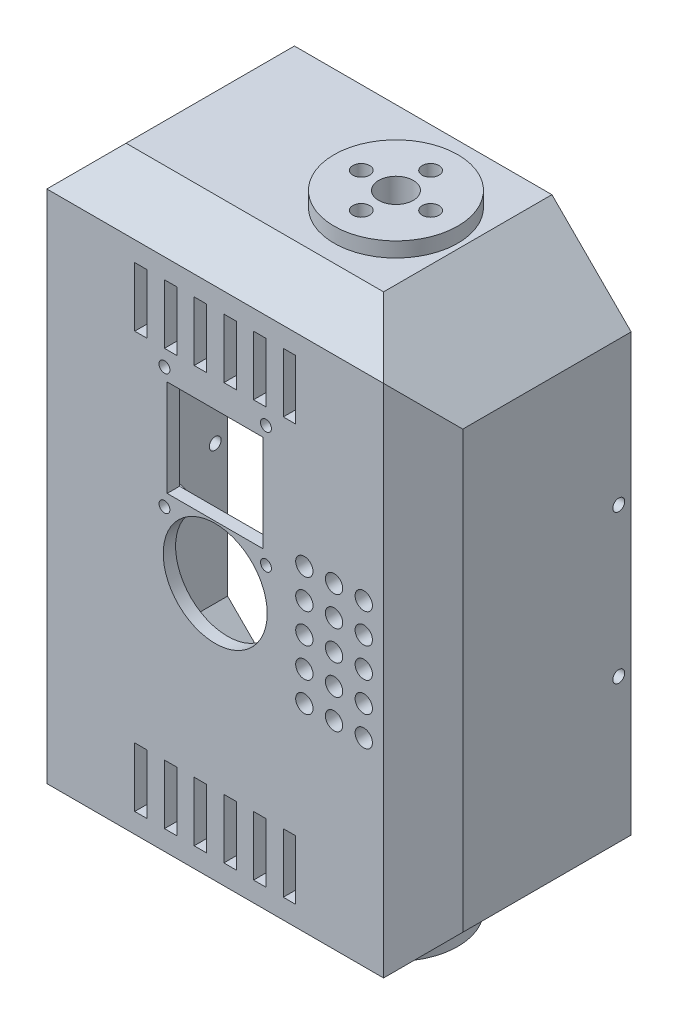
from build123d import *

# Parameters (mm, degrees)
BOSS_1_DEPTH    = 42
CUT_2_DEPTH     = 86
CUT_3_DEPTH     = 86
CUT_4_DEPTH     = 122
CUT_5_DEPTH     = 122
CUT_6_DEPTH     = 31.6
CUT_7_DEPTH     = 4.1
CUT_8_DEPTH     = 4.1
S_CUT9_W        = 2.5
S_CUT9_H        = 12
POCKET_9_DEPTH  = 2.7
S_CUT10_W       = 2.5
S_CUT10_H       = 12
POCKET_10_DEPTH = 2.7
S_CUT11_W       = 2.5
S_CUT11_H       = 12
POCKET_11_DEPTH = 2.7
S_CUT12_W       = 2.5
S_CUT12_H       = 12
POCKET_12_DEPTH = 2.7
S_CUT13_W       = 2.5
S_CUT13_H       = 12
POCKET_13_DEPTH = 2.7
S_CUT14_W       = 2.5
S_CUT14_H       = 12
POCKET_14_DEPTH = 2.7
S_HOLE15_R      = 1.2
HOLE_15_DEPTH   = 2.7
S_HOLE16_R      = 1.2
HOLE_16_DEPTH   = 2.7
S_CUT17_W       = 2.5
S_CUT17_H       = 12
POCKET_17_DEPTH = 2.7
S_CUT18_W       = 2.5
S_CUT18_H       = 12
POCKET_18_DEPTH = 2.7
S_CUT19_W       = 2.5
S_CUT19_H       = 12
POCKET_19_DEPTH = 2.7
S_CUT20_W       = 2.5
S_CUT20_H       = 12
POCKET_20_DEPTH = 2.7
S_CUT21_W       = 2.5
S_CUT21_H       = 12
POCKET_21_DEPTH = 2.7
S_CUT22_W       = 2.5
S_CUT22_H       = 12
POCKET_22_DEPTH = 2.7
S_HOLE23_R      = 1.2
HOLE_23_DEPTH   = 2.7
S_HOLE24_R      = 1.2
HOLE_24_DEPTH   = 2.7
S_HOLE25_R      = 1.75
HOLE_25_DEPTH   = 2.7
S_HOLE26_R      = 1.75
HOLE_26_DEPTH   = 2.7
S_HOLE27_R      = 1.75
HOLE_27_DEPTH   = 2.7
S_HOLE28_R      = 1.75
HOLE_28_DEPTH   = 2.7
S_HOLE29_R      = 1.75
HOLE_29_DEPTH   = 2.7
S_HOLE30_R      = 1.75
HOLE_30_DEPTH   = 2.7
S_HOLE31_R      = 1.75
HOLE_31_DEPTH   = 2.7
S_HOLE32_R      = 1.75
HOLE_32_DEPTH   = 2.7
S_HOLE33_R      = 1.75
HOLE_33_DEPTH   = 2.7
S_HOLE34_R      = 1.75
HOLE_34_DEPTH   = 2.7
S_HOLE35_R      = 1.75
HOLE_35_DEPTH   = 2.7
S_HOLE36_R      = 1.75
HOLE_36_DEPTH   = 2.7
S_HOLE37_R      = 1.75
HOLE_37_DEPTH   = 2.7
S_HOLE38_R      = 1.75
HOLE_38_DEPTH   = 2.7
S_HOLE39_R      = 1.75
HOLE_39_DEPTH   = 2.7
S_CYL40_R       = 12.5
BOSS_40_DEPTH   = 6
S_CYL41_R       = 12.5
BOSS_41_DEPTH   = 6
S_CYL42_R       = 2.5
BOSS_42_DEPTH   = 2
S_CYL43_R       = 2.5
BOSS_43_DEPTH   = 2
S_CYL44_R       = 2.5
BOSS_44_DEPTH   = 2
S_CYL45_R       = 2.5
BOSS_45_DEPTH   = 2
S_HOLE46_R      = 3.5
HOLE_46_DEPTH   = 6.2
S_HOLE47_R      = 1.7
HOLE_47_DEPTH   = 6.2
S_HOLE48_R      = 1.7
HOLE_48_DEPTH   = 6.2
S_HOLE49_R      = 1.7
HOLE_49_DEPTH   = 6.2
S_HOLE50_R      = 1.7
HOLE_50_DEPTH   = 6.2
S_HOLE51_R      = 3.2
HOLE_51_DEPTH   = 3.1
S_HOLE52_R      = 3.2
HOLE_52_DEPTH   = 3.1
S_HOLE53_R      = 3.2
HOLE_53_DEPTH   = 3.1
S_HOLE54_R      = 3.2
HOLE_54_DEPTH   = 3.1
S_HOLE55_R      = 3.5
HOLE_55_DEPTH   = 6.2
S_HOLE56_R      = 1.7
HOLE_56_DEPTH   = 6.2
S_HOLE57_R      = 1.7
HOLE_57_DEPTH   = 6.2
S_HOLE58_R      = 1.7
HOLE_58_DEPTH   = 6.2
S_HOLE59_R      = 1.7
HOLE_59_DEPTH   = 6.2
S_HOLE60_R      = 3.2
HOLE_60_DEPTH   = 3.1
S_HOLE61_R      = 3.2
HOLE_61_DEPTH   = 3.1
S_HOLE62_R      = 3.2
HOLE_62_DEPTH   = 3.1
S_HOLE63_R      = 3.2
HOLE_63_DEPTH   = 3.1
S_HOLE64_R      = 10.5
HOLE_64_DEPTH   = 6.1
S_CUT65_W       = 19.4
S_CUT65_H       = 19.5
POCKET_65_DEPTH = 6.1
S_HOLE66_R      = 1.1
HOLE_66_DEPTH   = 3.2
S_HOLE67_R      = 1.1
HOLE_67_DEPTH   = 3.2
S_HOLE68_R      = 1.1
HOLE_68_DEPTH   = 3.2
S_HOLE69_R      = 1.1
HOLE_69_DEPTH   = 3.2


with BuildPart() as part:
    # S_prism1 → Boss_1 (new body)
    with BuildSketch(Plane.XY.offset(194)):
        Polygon((42, -44), (42, 44), (26, 60), (-26, 60), (-42, 44), (-42, -44), (-26, -60), (26, -60), align=None)
    extrude(amount=BOSS_1_DEPTH)

    # S_pcut2 → Cut_2 (cut)
    with BuildSketch(Plane(origin=(-43, 0, 0), x_dir=(0, 0, -1), z_dir=(1, 0, 0))):
        Polygon((-236.6, 60.6), (-236.6, 51.4), (-227.4, 60.6), align=None)
    extrude(amount=CUT_2_DEPTH, mode=Mode.SUBTRACT)

    # S_pcut3 → Cut_3 (cut)
    with BuildSketch(Plane(origin=(-43, 0, 0), x_dir=(0, 0, -1), z_dir=(1, 0, 0))):
        Polygon((-236.6, -60.6), (-236.6, -51.4), (-227.4, -60.6), align=None)
    extrude(amount=CUT_3_DEPTH, mode=Mode.SUBTRACT)

    # S_pcut4 → Cut_4 (cut)
    with BuildSketch(Plane(origin=(0, -61, 0), x_dir=(1, 0, 0), z_dir=(0, 1, 0))):
        Polygon((42.6, -236.6), (33.4, -236.6), (42.6, -227.4), align=None)
    extrude(amount=CUT_4_DEPTH, mode=Mode.SUBTRACT)

    # S_pcut5 → Cut_5 (cut)
    with BuildSketch(Plane(origin=(0, -61, 0), x_dir=(1, 0, 0), z_dir=(0, 1, 0))):
        Polygon((-42.6, -236.6), (-33.4, -236.6), (-42.6, -227.4), align=None)
    extrude(amount=CUT_5_DEPTH, mode=Mode.SUBTRACT)

    # S_pcut6 → Cut_6 (cut)
    with BuildSketch(Plane.XY.offset(193.9)):
        Polygon((39.5, -42.964466094), (39.5, 42.964466094), (24.964466094, 57.5), (-24.964466094, 57.5), (-39.5, 42.964466094), (-39.5, -42.964466094), (-24.964466094, -57.5), (24.964466094, -57.5), align=None)
    extrude(amount=CUT_6_DEPTH, mode=Mode.SUBTRACT)

    # S_pcut7 → Cut_7 (cut)
    with BuildSketch(Plane.XY.offset(225.4)):
        Polygon((35.5, -41.307611845), (35.5, 41.307611845), (23.307611845, 53.5), (-23.307611845, 53.5), (-35.5, 41.307611845), (-35.5, -41.307611845), (-23.307611845, -53.5), (23.307611845, -53.5), align=None)
    extrude(amount=CUT_7_DEPTH, mode=Mode.SUBTRACT)

    # S_pcut8 → Cut_8 (cut)
    with BuildSketch(Plane.XY.offset(229.4)):
        Polygon((31.5, -39.650757595), (31.5, 39.650757595), (21.650757595, 49.5), (-21.650757595, 49.5), (-31.5, 39.650757595), (-31.5, -39.650757595), (-21.650757595, -49.5), (21.650757595, -49.5), align=None)
    extrude(amount=CUT_8_DEPTH, mode=Mode.SUBTRACT)

    # S_cut9 → Pocket_9 (cut)
    with BuildSketch(Plane.XY.offset(233.4)):
        with Locations((-15, 42)):
            Rectangle(S_CUT9_W, S_CUT9_H)
    extrude(amount=POCKET_9_DEPTH, mode=Mode.SUBTRACT)

    # S_cut10 → Pocket_10 (cut)
    with BuildSketch(Plane.XY.offset(233.4)):
        with Locations((-9, 42)):
            Rectangle(S_CUT10_W, S_CUT10_H)
    extrude(amount=POCKET_10_DEPTH, mode=Mode.SUBTRACT)

    # S_cut11 → Pocket_11 (cut)
    with BuildSketch(Plane.XY.offset(233.4)):
        with Locations((-3, 42)):
            Rectangle(S_CUT11_W, S_CUT11_H)
    extrude(amount=POCKET_11_DEPTH, mode=Mode.SUBTRACT)

    # S_cut12 → Pocket_12 (cut)
    with BuildSketch(Plane.XY.offset(233.4)):
        with Locations((3, 42)):
            Rectangle(S_CUT12_W, S_CUT12_H)
    extrude(amount=POCKET_12_DEPTH, mode=Mode.SUBTRACT)

    # S_cut13 → Pocket_13 (cut)
    with BuildSketch(Plane.XY.offset(233.4)):
        with Locations((9, 42)):
            Rectangle(S_CUT13_W, S_CUT13_H)
    extrude(amount=POCKET_13_DEPTH, mode=Mode.SUBTRACT)

    # S_cut14 → Pocket_14 (cut)
    with BuildSketch(Plane.XY.offset(233.4)):
        with Locations((15, 42)):
            Rectangle(S_CUT14_W, S_CUT14_H)
    extrude(amount=POCKET_14_DEPTH, mode=Mode.SUBTRACT)

    # S_hole15 → Hole_15 (cut)
    with BuildSketch(Plane(origin=(39.4, 0, 0), x_dir=(0, 0, -1), z_dir=(1, 0, 0))):
        with Locations((-196.5, -15)):
            Circle(S_HOLE15_R)
    extrude(amount=HOLE_15_DEPTH, mode=Mode.SUBTRACT)

    # S_hole16 → Hole_16 (cut)
    with BuildSketch(Plane(origin=(39.4, 0, 0), x_dir=(0, 0, -1), z_dir=(1, 0, 0))):
        with Locations((-196.5, 15)):
            Circle(S_HOLE16_R)
    extrude(amount=HOLE_16_DEPTH, mode=Mode.SUBTRACT)

    # S_cut17 → Pocket_17 (cut)
    with BuildSketch(Plane.XY.offset(233.4)):
        with Locations((-15, -42)):
            Rectangle(S_CUT17_W, S_CUT17_H)
    extrude(amount=POCKET_17_DEPTH, mode=Mode.SUBTRACT)

    # S_cut18 → Pocket_18 (cut)
    with BuildSketch(Plane.XY.offset(233.4)):
        with Locations((-9, -42)):
            Rectangle(S_CUT18_W, S_CUT18_H)
    extrude(amount=POCKET_18_DEPTH, mode=Mode.SUBTRACT)

    # S_cut19 → Pocket_19 (cut)
    with BuildSketch(Plane.XY.offset(233.4)):
        with Locations((-3, -42)):
            Rectangle(S_CUT19_W, S_CUT19_H)
    extrude(amount=POCKET_19_DEPTH, mode=Mode.SUBTRACT)

    # S_cut20 → Pocket_20 (cut)
    with BuildSketch(Plane.XY.offset(233.4)):
        with Locations((3, -42)):
            Rectangle(S_CUT20_W, S_CUT20_H)
    extrude(amount=POCKET_20_DEPTH, mode=Mode.SUBTRACT)

    # S_cut21 → Pocket_21 (cut)
    with BuildSketch(Plane.XY.offset(233.4)):
        with Locations((9, -42)):
            Rectangle(S_CUT21_W, S_CUT21_H)
    extrude(amount=POCKET_21_DEPTH, mode=Mode.SUBTRACT)

    # S_cut22 → Pocket_22 (cut)
    with BuildSketch(Plane.XY.offset(233.4)):
        with Locations((15, -42)):
            Rectangle(S_CUT22_W, S_CUT22_H)
    extrude(amount=POCKET_22_DEPTH, mode=Mode.SUBTRACT)

    # S_hole23 → Hole_23 (cut)
    with BuildSketch(Plane(origin=(-42.1, 0, 0), x_dir=(0, 0, -1), z_dir=(1, 0, 0))):
        with Locations((-196.5, -15)):
            Circle(S_HOLE23_R)
    extrude(amount=HOLE_23_DEPTH, mode=Mode.SUBTRACT)

    # S_hole24 → Hole_24 (cut)
    with BuildSketch(Plane(origin=(-42.1, 0, 0), x_dir=(0, 0, -1), z_dir=(1, 0, 0))):
        with Locations((-196.5, 15)):
            Circle(S_HOLE24_R)
    extrude(amount=HOLE_24_DEPTH, mode=Mode.SUBTRACT)

    # S_hole25 → Hole_25 (cut)
    with BuildSketch(Plane.XY.offset(233.4)):
        with Locations((18, -12)):
            Circle(S_HOLE25_R)
    extrude(amount=HOLE_25_DEPTH, mode=Mode.SUBTRACT)

    # S_hole26 → Hole_26 (cut)
    with BuildSketch(Plane.XY.offset(233.4)):
        with Locations((18, -6)):
            Circle(S_HOLE26_R)
    extrude(amount=HOLE_26_DEPTH, mode=Mode.SUBTRACT)

    # S_hole27 → Hole_27 (cut)
    with BuildSketch(Plane.XY.offset(233.4)):
        with Locations((18, 0)):
            Circle(S_HOLE27_R)
    extrude(amount=HOLE_27_DEPTH, mode=Mode.SUBTRACT)

    # S_hole28 → Hole_28 (cut)
    with BuildSketch(Plane.XY.offset(233.4)):
        with Locations((18, 6)):
            Circle(S_HOLE28_R)
    extrude(amount=HOLE_28_DEPTH, mode=Mode.SUBTRACT)

    # S_hole29 → Hole_29 (cut)
    with BuildSketch(Plane.XY.offset(233.4)):
        with Locations((18, 12)):
            Circle(S_HOLE29_R)
    extrude(amount=HOLE_29_DEPTH, mode=Mode.SUBTRACT)

    # S_hole30 → Hole_30 (cut)
    with BuildSketch(Plane.XY.offset(233.4)):
        with Locations((24, -12)):
            Circle(S_HOLE30_R)
    extrude(amount=HOLE_30_DEPTH, mode=Mode.SUBTRACT)

    # S_hole31 → Hole_31 (cut)
    with BuildSketch(Plane.XY.offset(233.4)):
        with Locations((24, -6)):
            Circle(S_HOLE31_R)
    extrude(amount=HOLE_31_DEPTH, mode=Mode.SUBTRACT)

    # S_hole32 → Hole_32 (cut)
    with BuildSketch(Plane.XY.offset(233.4)):
        with Locations((24, 0)):
            Circle(S_HOLE32_R)
    extrude(amount=HOLE_32_DEPTH, mode=Mode.SUBTRACT)

    # S_hole33 → Hole_33 (cut)
    with BuildSketch(Plane.XY.offset(233.4)):
        with Locations((24, 6)):
            Circle(S_HOLE33_R)
    extrude(amount=HOLE_33_DEPTH, mode=Mode.SUBTRACT)

    # S_hole34 → Hole_34 (cut)
    with BuildSketch(Plane.XY.offset(233.4)):
        with Locations((24, 12)):
            Circle(S_HOLE34_R)
    extrude(amount=HOLE_34_DEPTH, mode=Mode.SUBTRACT)

    # S_hole35 → Hole_35 (cut)
    with BuildSketch(Plane.XY.offset(233.4)):
        with Locations((30, -12)):
            Circle(S_HOLE35_R)
    extrude(amount=HOLE_35_DEPTH, mode=Mode.SUBTRACT)

    # S_hole36 → Hole_36 (cut)
    with BuildSketch(Plane.XY.offset(233.4)):
        with Locations((30, -6)):
            Circle(S_HOLE36_R)
    extrude(amount=HOLE_36_DEPTH, mode=Mode.SUBTRACT)

    # S_hole37 → Hole_37 (cut)
    with BuildSketch(Plane.XY.offset(233.4)):
        with Locations((30, 0)):
            Circle(S_HOLE37_R)
    extrude(amount=HOLE_37_DEPTH, mode=Mode.SUBTRACT)

    # S_hole38 → Hole_38 (cut)
    with BuildSketch(Plane.XY.offset(233.4)):
        with Locations((30, 6)):
            Circle(S_HOLE38_R)
    extrude(amount=HOLE_38_DEPTH, mode=Mode.SUBTRACT)

    # S_hole39 → Hole_39 (cut)
    with BuildSketch(Plane.XY.offset(233.4)):
        with Locations((30, 12)):
            Circle(S_HOLE39_R)
    extrude(amount=HOLE_39_DEPTH, mode=Mode.SUBTRACT)

    # S_cyl40 → Boss_40 (add)
    with BuildSketch(Plane(origin=(0, 57, 0), x_dir=(1, 0, 0), z_dir=(0, 1, 0))):
        with Locations((12.5, -212)):
            Circle(S_CYL40_R)
    extrude(amount=BOSS_40_DEPTH)

    # S_cyl41 → Boss_41 (add)
    with BuildSketch(Plane(origin=(0, -63, 0), x_dir=(1, 0, 0), z_dir=(0, 1, 0))):
        with Locations((12.5, -212)):
            Circle(S_CYL41_R)
    extrude(amount=BOSS_41_DEPTH)

    # S_cyl42 → Boss_42 (add)
    with BuildSketch(Plane.XY.offset(233)):
        with Locations((-10.25, 8.3)):
            Circle(S_CYL42_R)
    extrude(amount=BOSS_42_DEPTH)

    # S_cyl43 → Boss_43 (add)
    with BuildSketch(Plane.XY.offset(233)):
        with Locations((10.25, 8.3)):
            Circle(S_CYL43_R)
    extrude(amount=BOSS_43_DEPTH)

    # S_cyl44 → Boss_44 (add)
    with BuildSketch(Plane.XY.offset(233)):
        with Locations((-10.25, 32.75)):
            Circle(S_CYL44_R)
    extrude(amount=BOSS_44_DEPTH)

    # S_cyl45 → Boss_45 (add)
    with BuildSketch(Plane.XY.offset(233)):
        with Locations((10.25, 32.75)):
            Circle(S_CYL45_R)
    extrude(amount=BOSS_45_DEPTH)

    # S_hole46 → Hole_46 (cut)
    with BuildSketch(Plane(origin=(0, 56.9, 0), x_dir=(1, 0, 0), z_dir=(0, 1, 0))):
        with Locations((12.5, -212)):
            Circle(S_HOLE46_R)
    extrude(amount=HOLE_46_DEPTH, mode=Mode.SUBTRACT)

    # S_hole47 → Hole_47 (cut)
    with BuildSketch(Plane(origin=(0, 56.9, 0), x_dir=(1, 0, 0), z_dir=(0, 1, 0))):
        with Locations((19.5, -212)):
            Circle(S_HOLE47_R)
    extrude(amount=HOLE_47_DEPTH, mode=Mode.SUBTRACT)

    # S_hole48 → Hole_48 (cut)
    with BuildSketch(Plane(origin=(0, 56.9, 0), x_dir=(1, 0, 0), z_dir=(0, 1, 0))):
        with Locations((12.5, -219)):
            Circle(S_HOLE48_R)
    extrude(amount=HOLE_48_DEPTH, mode=Mode.SUBTRACT)

    # S_hole49 → Hole_49 (cut)
    with BuildSketch(Plane(origin=(0, 56.9, 0), x_dir=(1, 0, 0), z_dir=(0, 1, 0))):
        with Locations((5.5, -212)):
            Circle(S_HOLE49_R)
    extrude(amount=HOLE_49_DEPTH, mode=Mode.SUBTRACT)

    # S_hole50 → Hole_50 (cut)
    with BuildSketch(Plane(origin=(0, 56.9, 0), x_dir=(1, 0, 0), z_dir=(0, 1, 0))):
        with Locations((12.5, -205)):
            Circle(S_HOLE50_R)
    extrude(amount=HOLE_50_DEPTH, mode=Mode.SUBTRACT)

    # S_hole51 → Hole_51 (cut)
    with BuildSketch(Plane(origin=(0, 56.9, 0), x_dir=(1, 0, 0), z_dir=(0, 1, 0))):
        with Locations((19.5, -212)):
            Circle(S_HOLE51_R)
    extrude(amount=HOLE_51_DEPTH, mode=Mode.SUBTRACT)

    # S_hole52 → Hole_52 (cut)
    with BuildSketch(Plane(origin=(0, 56.9, 0), x_dir=(1, 0, 0), z_dir=(0, 1, 0))):
        with Locations((12.5, -219)):
            Circle(S_HOLE52_R)
    extrude(amount=HOLE_52_DEPTH, mode=Mode.SUBTRACT)

    # S_hole53 → Hole_53 (cut)
    with BuildSketch(Plane(origin=(0, 56.9, 0), x_dir=(1, 0, 0), z_dir=(0, 1, 0))):
        with Locations((5.5, -212)):
            Circle(S_HOLE53_R)
    extrude(amount=HOLE_53_DEPTH, mode=Mode.SUBTRACT)

    # S_hole54 → Hole_54 (cut)
    with BuildSketch(Plane(origin=(0, 56.9, 0), x_dir=(1, 0, 0), z_dir=(0, 1, 0))):
        with Locations((12.5, -205)):
            Circle(S_HOLE54_R)
    extrude(amount=HOLE_54_DEPTH, mode=Mode.SUBTRACT)

    # S_hole55 → Hole_55 (cut)
    with BuildSketch(Plane(origin=(0, -63.1, 0), x_dir=(1, 0, 0), z_dir=(0, 1, 0))):
        with Locations((12.5, -212)):
            Circle(S_HOLE55_R)
    extrude(amount=HOLE_55_DEPTH, mode=Mode.SUBTRACT)

    # S_hole56 → Hole_56 (cut)
    with BuildSketch(Plane(origin=(0, -63.1, 0), x_dir=(1, 0, 0), z_dir=(0, 1, 0))):
        with Locations((19.5, -212)):
            Circle(S_HOLE56_R)
    extrude(amount=HOLE_56_DEPTH, mode=Mode.SUBTRACT)

    # S_hole57 → Hole_57 (cut)
    with BuildSketch(Plane(origin=(0, -63.1, 0), x_dir=(1, 0, 0), z_dir=(0, 1, 0))):
        with Locations((12.5, -219)):
            Circle(S_HOLE57_R)
    extrude(amount=HOLE_57_DEPTH, mode=Mode.SUBTRACT)

    # S_hole58 → Hole_58 (cut)
    with BuildSketch(Plane(origin=(0, -63.1, 0), x_dir=(1, 0, 0), z_dir=(0, 1, 0))):
        with Locations((5.5, -212)):
            Circle(S_HOLE58_R)
    extrude(amount=HOLE_58_DEPTH, mode=Mode.SUBTRACT)

    # S_hole59 → Hole_59 (cut)
    with BuildSketch(Plane(origin=(0, -63.1, 0), x_dir=(1, 0, 0), z_dir=(0, 1, 0))):
        with Locations((12.5, -205)):
            Circle(S_HOLE59_R)
    extrude(amount=HOLE_59_DEPTH, mode=Mode.SUBTRACT)

    # S_hole60 → Hole_60 (cut)
    with BuildSketch(Plane(origin=(0, -60, 0), x_dir=(1, 0, 0), z_dir=(0, 1, 0))):
        with Locations((19.5, -212)):
            Circle(S_HOLE60_R)
    extrude(amount=HOLE_60_DEPTH, mode=Mode.SUBTRACT)

    # S_hole61 → Hole_61 (cut)
    with BuildSketch(Plane(origin=(0, -60, 0), x_dir=(1, 0, 0), z_dir=(0, 1, 0))):
        with Locations((12.5, -219)):
            Circle(S_HOLE61_R)
    extrude(amount=HOLE_61_DEPTH, mode=Mode.SUBTRACT)

    # S_hole62 → Hole_62 (cut)
    with BuildSketch(Plane(origin=(0, -60, 0), x_dir=(1, 0, 0), z_dir=(0, 1, 0))):
        with Locations((5.5, -212)):
            Circle(S_HOLE62_R)
    extrude(amount=HOLE_62_DEPTH, mode=Mode.SUBTRACT)

    # S_hole63 → Hole_63 (cut)
    with BuildSketch(Plane(origin=(0, -60, 0), x_dir=(1, 0, 0), z_dir=(0, 1, 0))):
        with Locations((12.5, -205)):
            Circle(S_HOLE63_R)
    extrude(amount=HOLE_63_DEPTH, mode=Mode.SUBTRACT)

    # S_hole64 → Hole_64 (cut)
    with BuildSketch(Plane.XY.offset(230)):
        Circle(S_HOLE64_R)
    extrude(amount=HOLE_64_DEPTH, mode=Mode.SUBTRACT)

    # S_cut65 → Pocket_65 (cut)
    with BuildSketch(Plane.XY.offset(230)):
        with Locations((0, 20.65)):
            Rectangle(S_CUT65_W, S_CUT65_H)
    extrude(amount=POCKET_65_DEPTH, mode=Mode.SUBTRACT)

    # S_hole66 → Hole_66 (cut)
    with BuildSketch(Plane.XY.offset(232.9)):
        with Locations((-10.25, 8.3)):
            Circle(S_HOLE66_R)
    extrude(amount=HOLE_66_DEPTH, mode=Mode.SUBTRACT)

    # S_hole67 → Hole_67 (cut)
    with BuildSketch(Plane.XY.offset(232.9)):
        with Locations((10.25, 8.3)):
            Circle(S_HOLE67_R)
    extrude(amount=HOLE_67_DEPTH, mode=Mode.SUBTRACT)

    # S_hole68 → Hole_68 (cut)
    with BuildSketch(Plane.XY.offset(232.9)):
        with Locations((-10.25, 32.75)):
            Circle(S_HOLE68_R)
    extrude(amount=HOLE_68_DEPTH, mode=Mode.SUBTRACT)

    # S_hole69 → Hole_69 (cut)
    with BuildSketch(Plane.XY.offset(232.9)):
        with Locations((10.25, 32.75)):
            Circle(S_HOLE69_R)
    extrude(amount=HOLE_69_DEPTH, mode=Mode.SUBTRACT)


solid = part.part
